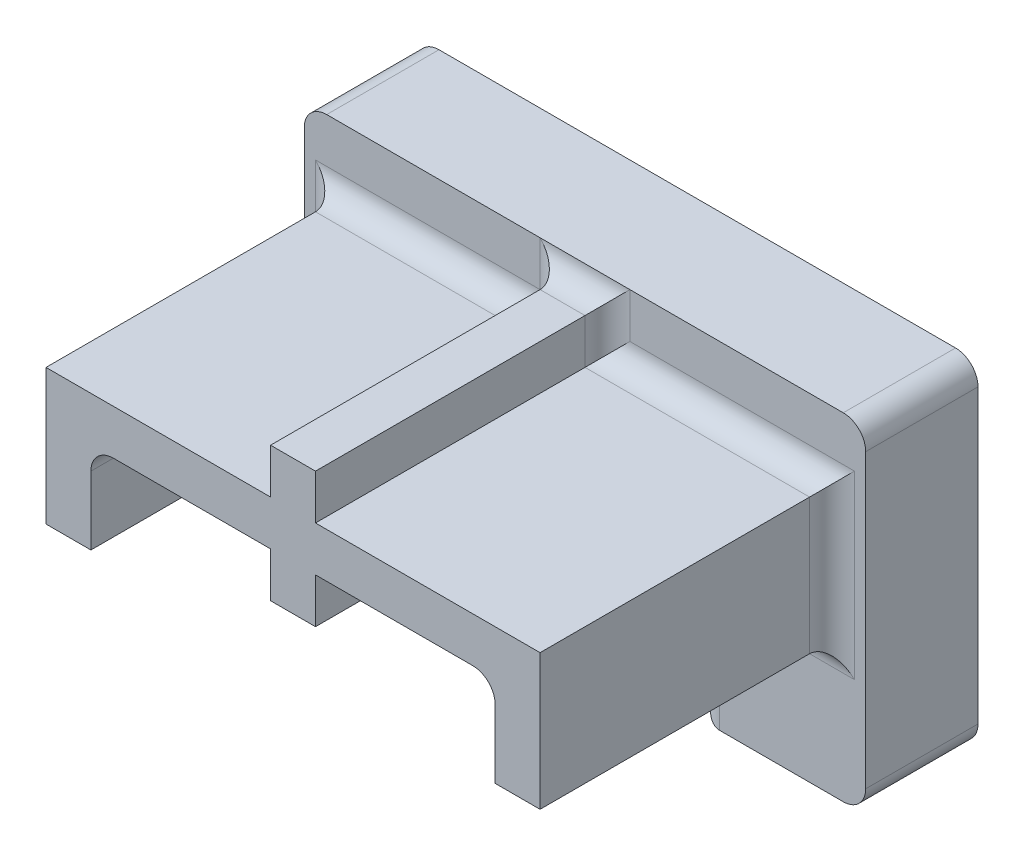
from build123d import *

# Parameters (mm, degrees)
RESSALTO_EXTRUS_O1_DEPTH = 10
FILETE1_R                = 2
FILETE2_R                = 2
RESSALTO_EXTRUS_O2_DEPTH = 26
FILETE4_R                = 2
FILETE6_R                = 2


with BuildPart() as part:
    # Esboço1 → Ressalto-extrusão1 (new body)
    with BuildSketch(Plane.XY):
        Polygon((-17.957860615883305, -18.6871961102107), (-2.9578606158833054, -18.687196110210696), (-2.957860615883306, -13.687196110210696), (-2.957860615883306, -8.687196110210698), (7.042139384116819, -8.687196110210696), (7.042139384116693, 11.312803889789302), (-17.95786061588331, 11.312803889789302), align=None)
        with BuildLine():
            Line((-2.957860615883306, -8.687196110210698), (-2.957860615883306, -13.687196110210696))
            ThreePointArc((-2.9578606158833054, -13.687196110210696), (1.451969440367277, -10.006856222711722), (7.042139384116818, -8.6871961102107))
            Line((7.042139384116819, -8.687196110210696), (-2.957860615883306, -8.687196110210698))
        make_face()
        Polygon((7.042139384116693, 11.312803889789302), (7.0421393841166955, -8.687196110210698), (17.042139384116695, -8.687196110210696), (17.042139384116698, -13.687196110210698), (17.042139384116698, -18.687196110210696), (32.042139384116695, -18.687196110210692), (32.042139384116695, 11.31280388978931), align=None)
        with BuildLine():
            Line((17.042139384116695, -8.687196110210696), (7.042139384116819, -8.687196110210696))
            ThreePointArc((7.042139384116818, -8.6871961102107), (12.632309327866226, -10.006856222711777), (17.0421393841167, -13.687196110210698))
            Line((17.042139384116698, -13.687196110210698), (17.042139384116695, -8.687196110210696))
        make_face()
    extrude(amount=RESSALTO_EXTRUS_O1_DEPTH)

    # Filete1
    filete1_edges = [part.edges().sort_by_distance(p)[0] for p in [
        (17.042139384116695, -16.187196110210696, 10),
        (17.042139384116695, -16.187196110210696, 0),
        (7.042139384116695, -8.6871961102107, 0),
        (-2.9578606158833054, -13.687196110210696, 5),
        (-2.9578606158833054, -18.6871961102107, 5),
        (17.042139384116695, -18.687196110210696, 5),
        (17.0421393841167, -13.687196110210698, 5),
        (-2.9578606158833054, -16.1871961102107, 10),
        (7.042139384116694, -8.6871961102107, 10),
        (-2.9578606158833054, -16.1871961102107, 0),
    ]]
    fillet(filete1_edges, radius=FILETE1_R)

    # Filete2
    filete2_edges = [part.edges().sort_by_distance(p)[0] for p in [
        (-17.957860615883305, -18.6871961102107, 5),
        (-17.95786061588331, 11.312803889789302, 5),
        (32.042139384116695, 11.31280388978931, 5),
        (32.042139384116695, -18.687196110210692, 5),
    ]]
    fillet(filete2_edges, radius=FILETE2_R)

    # Esboço2 → Ressalto-extrusão2 (add)
    with BuildSketch(Plane.XY.offset(10)):
        Polygon((9.042139384116691, 9.312803889789297), (5.042139384116695, 9.312803889789297), (5.042139384116695, 5.312803889789297), (-14.957860615883307, 5.312803889789293), (-14.957860615883302, -6.771146492865117), (-10.957860615883302, -6.771146492865116), (-10.957860615883309, 1.312803889789298), (5.042139384116695, 1.3128038897893), (5.042139384116695, -2.6871961102106985), (9.042139384116695, -2.687196110210697), (9.042139384116693, 1.3128038897892964), (25.04213938411669, 1.3128038897893024), (25.042139384116695, -6.771146492865112), (29.042139384116695, -6.771146492865111), (29.042139384116695, 5.312803889789296), (9.042139384116693, 5.312803889789297), align=None)
    extrude(amount=RESSALTO_EXTRUS_O2_DEPTH)

    # Filete4
    filete4_edges = [part.edges().sort_by_distance(p)[0] for p in [
        (-10.957860615883309, 1.312803889789298, 23),
        (25.042139384116695, 1.3128038897893024, 23),
    ]]
    fillet(filete4_edges, radius=FILETE4_R)

    # Filete6
    filete6_edges = [part.edges().sort_by_distance(p)[0] for p in [
        (-14.957860615883305, -0.729171301537912, 10),
        (27.042139384116695, -6.771146492865111, 10),
        (29.042139384116695, -0.7291713015379075, 10),
        (7.042139384116693, 9.312803889789297, 10),
        (5.042139384116695, 7.312803889789297, 10),
        (-4.957860615883305, 5.312803889789295, 10),
        (9.042139384116691, 7.312803889789297, 10),
        (19.042139384116695, 5.312803889789297, 10),
        (-12.957860615883302, -6.771146492865116, 10),
    ]]
    fillet(filete6_edges, radius=FILETE6_R - 0.0001)  # a hair under: the kernel refuses the full size


solid = part.part
